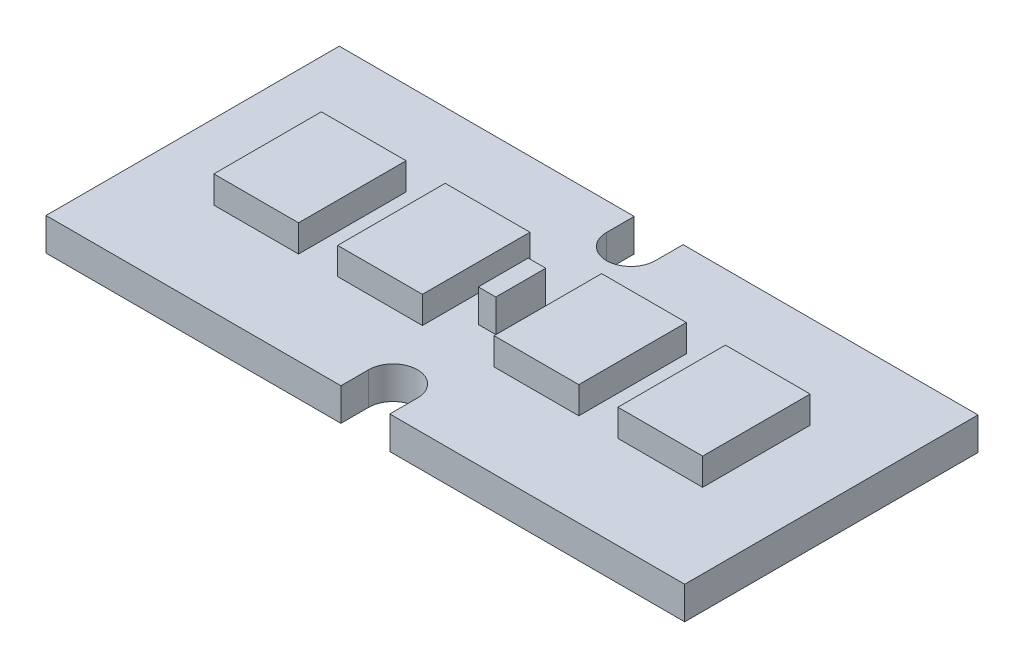
from build123d import *

# Parameters (mm, degrees)
SKETCH_1_W          = 19.6
SKETCH_1_H          = 9
EXTRUDE_1_DEPTH     = 1
CUT_EXTRUDE_1_DEPTH = 11.830050785
SKETCH_4_W          = 2.6
SKETCH_4_H          = 3.3
EXTRUDE_2_DEPTH     = 0.83
SKETCH_3_W          = 0.537571624
SKETCH_3_H          = 1.530011548
EXTRUDE_3_DEPTH     = 1


with BuildPart() as part:
    # 草图1 → 凸台-拉伸1 (new body)
    with BuildSketch(Plane(origin=(0, 0, 0), x_dir=(1, 0, 0), z_dir=(0, 1, 0))):
        Rectangle(SKETCH_1_W, SKETCH_1_H)
    extrude(amount=EXTRUDE_1_DEPTH)

    # 草图2 → 切除-拉伸1 (cut, through all)
    with BuildSketch(Plane(origin=(0, 1, 0), x_dir=(1, 0, 0), z_dir=(0, 1, 0))):
        with BuildLine():
            Line((0.75, 4.5), (-0.75, 4.5))
            Line((-0.75, 4.5), (-0.75, 3.65))
            ThreePointArc((-0.75, 3.65), (0, 2.9), (0.75, 3.65))
            Line((0.75, 3.65), (0.75, 4.5))
        make_face()
        with BuildLine():
            ThreePointArc((0.75, -3.65), (0, -2.9), (-0.75, -3.65))
            Line((-0.75, -3.65), (-0.75, -4.5))
            Line((-0.75, -4.5), (0.75, -4.5))
            Line((0.75, -4.5), (0.75, -3.65))
        make_face()
    extrude(amount=-CUT_EXTRUDE_1_DEPTH, mode=Mode.SUBTRACT)

    # 草图4 → 凸台-拉伸2 (add)
    with BuildSketch(Plane(origin=(0, 1, 0), x_dir=(1, 0, 0), z_dir=(0, 1, 0))):
        with Locations((-2.4, 0)):
            Rectangle(SKETCH_4_W, SKETCH_4_H)
        with Locations((-6.2, 0)):
            Rectangle(SKETCH_4_W, SKETCH_4_H)
        with Locations((2.4, 0)):
            Rectangle(SKETCH_4_W, SKETCH_4_H)
        with Locations((6.2, 0)):
            Rectangle(SKETCH_4_W, SKETCH_4_H)
    extrude(amount=EXTRUDE_2_DEPTH)

    # 草图3 → 凸台-拉伸3 (add)
    with BuildSketch(Plane(origin=(0, 1, 0), x_dir=(1, 0, 0), z_dir=(0, 1, 0))):
        Rectangle(SKETCH_3_W, SKETCH_3_H)
    extrude(amount=EXTRUDE_3_DEPTH)


solid = part.part
